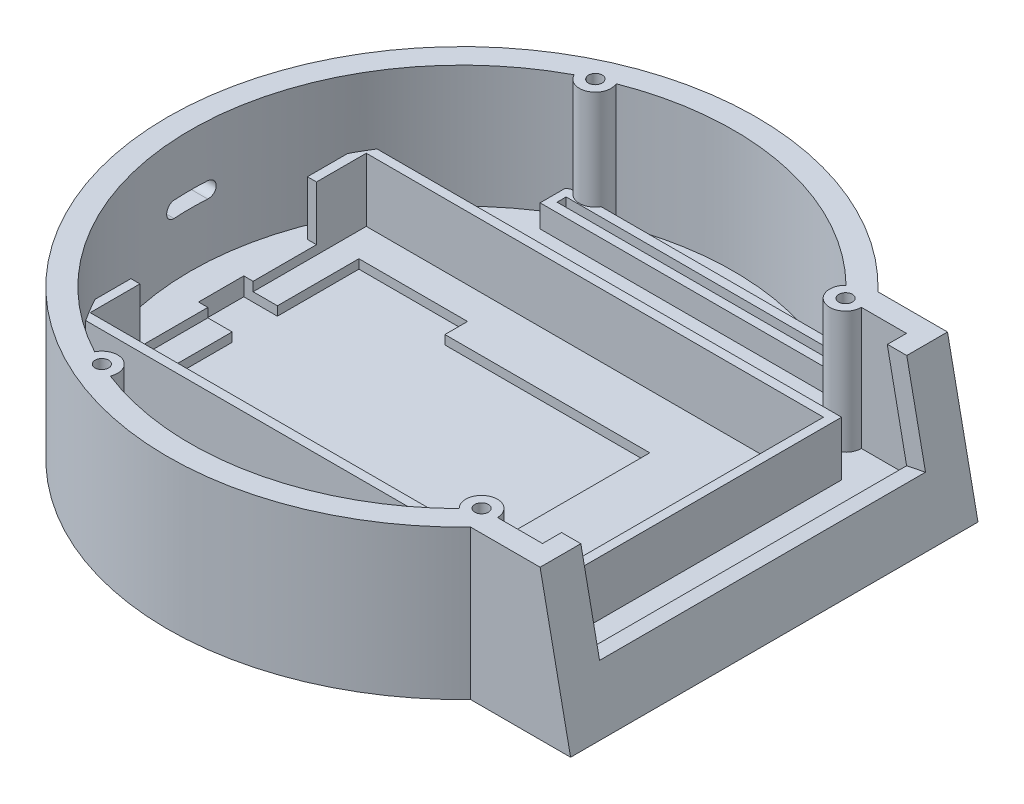
from build123d import *
from build123d.topology import SkipClean

# Parameters (mm, degrees)
SKETCH1_R                     = 65
SKETCH1_W                     = 44
SKETCH1_H                     = 90
HOUSING_DEPTH                 = 33
INTERNALCUT_DEPTH             = 27
SKETCH7_W                     = 72
SKETCH7_H                     = 25
DISPLAYCUT_DEPTH              = 27
SKETCH11_R                    = 18
WICHARGERCUT_DEPTH            = 4
SKETCH14_W                    = 6.2
SKETCH14_H                    = 6.2
BTNINTERNALCUT_DEPTH          = 3
SKETCH16_R                    = 1.9
BTNEXTERNALCUT_DEPTH          = 140.414406221
SKETCH18_R                    = 6
BUZZEREXTERNALCUT_DEPTH       = 4
SKETCH20_R                    = 0.35
BUZZERINTERNALCUT_DEPTH       = 134.776565507
SWITCHINTERNALCUT_OUTLINE_W   = 6.3
SWITCHINTERNALCUT_OUTLINE_H   = 20.3
SWITCHINTERNALCUT_DEPTH       = 0.01
SKETCH25_W                    = 4.1
SKETCH25_H                    = 7
SWITCHEXTERNALCUT_DEPTH       = 151.418380244
MICROUSBCUT_DEPTH             = 153.545075306
SKETCH29_R                    = 3.5
SKETCH29_R_2                  = 1.5
SCREWHOLESEXTERNAL_DEPTH      = 27
SCREWHOLESINTERNAL_DEPTH      = 99.564699657
SCREWHOLESINTERNAL_DEPTH_BACK = 99.564699657
SKETCH30_R                    = 1.5
SKETCH31_W                    = 59.5
SKETCH31_H                    = 2
CARDREADER_DEPTH              = 5
BATTERY_DEPTH                 = 12
SKETCH34_W                    = 68
SKETCH34_H                    = 36
WICHARGERCUT2_DEPTH           = 4
SKETCH35_W                    = 24
SKETCH35_H                    = 46
CHARGERMODULECUT_DEPTH        = 4
SKETCH36_W                    = 18.34349304
SKETCH36_H                    = 10
CHARGERCABLECUT_DEPTH         = 4
SKETCH37_R                    = 3
SKETCH37_R_2                  = 1.5
BUZZERATTACHTMENT_DEPTH       = 5
SKETCH39_W                    = 11
SKETCH39_H                    = 33
NEWEXT_DEPTH                  = 90
DIAGONALCUT_DEPTH             = 90
DISPLAYINTERNALCUT_START      = -4.8
DISPLAYINTERNALCUT_DEPTH      = 80.4
SKETCH45_W                    = 72
SKETCH45_H                    = 22
DISPLAYCUT2_DEPTH             = 5
SKETCH47_W                    = 101
SKETCH47_H                    = 61
CUT_EXTRUDE1_DEPTH            = 2
SKETCH49_R                    = 1.5
CUT_EXTRUDE2_DEPTH            = 99.561960808


# Read off the part's stored shape, not the designer's step: SwitchInternalCut
with BuildPart() as part:
    # Sketch1 → Housing (new body)
    with BuildSketch(Plane(origin=(0, 0, 0), x_dir=(1, 0, 0), z_dir=(0, 1, 0))):
        Circle(SKETCH1_R)
        with Locations((47, -0.0001724)):
            Rectangle(SKETCH1_W, SKETCH1_H)
    extrude(amount=HOUSING_DEPTH)

    # Sketch8 → InternalCut (cut)
    with BuildSketch(Plane(origin=(0, 33, 0), x_dir=(1, 0, 0), z_dir=(0, 1, 0))):
        with BuildLine():
            ThreePointArc((44.541821482, 40.1998276), (-60, 0.000232232), (44.541510291, -40.2001724))
            Line((44.541510291, -40.2001724), (19.336952431, -40.2001724))
            Line((19.336952431, -40.2001724), (19.336952431, 40.1998276))
            Line((19.336952431, 40.1998276), (44.541821482, 40.1998276))
        make_face()
        with BuildLine():
            Line((19.336952431, -40.2001724), (44.541510291, -40.2001724))
            ThreePointArc((44.541510291, -40.2001724), (56.002190214, -21.53496439), (60, 0))
            ThreePointArc((60, 0), (56.002273565, 21.534747631), (44.541821482, 40.1998276))
            Line((44.541821482, 40.1998276), (19.336952431, 40.1998276))
            Line((19.336952431, 40.1998276), (19.336952431, -40.2001724))
        make_face()
        with BuildLine():
            ThreePointArc((44.541821482, 40.1998276), (-60, 0.000232232), (44.541510291, -40.2001724))
            Line((44.541510291, -40.2001724), (19.336952431, -40.2001724))
            Line((19.336952431, -40.2001724), (19.336952431, 40.1998276))
            Line((19.336952431, 40.1998276), (44.541821482, 40.1998276))
        make_face()
        with BuildLine():
            Line((19.336952431, -40.2001724), (44.541510291, -40.2001724))
            ThreePointArc((44.541510291, -40.2001724), (56.002190214, -21.53496439), (60, 0))
            ThreePointArc((60, 0), (56.002273565, 21.534747631), (44.541821482, 40.1998276))
            Line((44.541821482, 40.1998276), (19.336952431, 40.1998276))
            Line((19.336952431, 40.1998276), (19.336952431, -40.2001724))
        make_face()
        with BuildLine():
            Line((44.541510291, -40.2001724), (64, -40.2001724))
            Line((64, -40.2001724), (64, 40.1998276))
            Line((64, 40.1998276), (44.541821482, 40.1998276))
            ThreePointArc((44.541821482, 40.1998276), (56.002273565, 21.534747631), (60, 0))
            ThreePointArc((60, 0), (56.002190214, -21.53496439), (44.541510291, -40.2001724))
        make_face()
    extrude(amount=-INTERNALCUT_DEPTH, mode=Mode.SUBTRACT)

    # Sketch7 → DisplayCut (cut)
    with BuildSketch(Plane(origin=(69, 0, 0), x_dir=(0, 0, -1), z_dir=(1, 0, 0))):
        with Locations((-0.0001724, 25.5)):
            Rectangle(SKETCH7_W, SKETCH7_H)
    extrude(amount=-DISPLAYCUT_DEPTH, mode=Mode.SUBTRACT)

    # Sketch11 → WiChargerCut (cut)
    with BuildSketch(Plane(origin=(0, 6, 0), x_dir=(1, 0, 0), z_dir=(0, 1, 0))):
        with Locations(Location((0, 0, 0), (0, 0, 270))):
            Circle(SKETCH11_R)
    extrude(amount=-WICHARGERCUT_DEPTH, mode=Mode.SUBTRACT)

    # Sketch14 → BtnInternalCut (cut)
    with BuildSketch(Plane(origin=(30.518997778, 6, -32.018027838), x_dir=(1, 0, 0), z_dir=(0, 1, 0))):
        with Locations((-1.004569722, -74.17253241)):
            Rectangle(SKETCH14_W, SKETCH14_H)
    extrude(amount=-BTNINTERNALCUT_DEPTH, mode=Mode.SUBTRACT)

    # Sketch16 → BtnExternalCut (cut, through all)
    with BuildSketch(Plane(origin=(30.518997778, 3, -32.018027838), x_dir=(1, 0, 0), z_dir=(0, 1, 0))):
        with Locations(Location((-1.004569722, -74.17253241, 0), (0, 0, 270))):
            Circle(SKETCH16_R)
    extrude(amount=-BTNEXTERNALCUT_DEPTH, mode=Mode.SUBTRACT)

    # Sketch18 → BuzzerExternalCut (cut)
    with BuildSketch(Plane(origin=(7.487765852, 6, 43.077256075), x_dir=(1, 0, 0), z_dir=(0, 1, 0))):
        with Locations(Location((-25.006618322, 0, 0), (0, 0, 270))):
            Circle(SKETCH18_R)
    extrude(amount=-BUZZEREXTERNALCUT_DEPTH, mode=Mode.SUBTRACT)

    # Sketch20 → BuzzerInternalCut (cut, through all)
    with BuildSketch(Plane(origin=(7.487765852, 2, 43.077256075), x_dir=(1, 0, 0), z_dir=(0, 1, 0))):
        with Locations(Location((-24.042348329, 4.522315504, 0), (0, 0, 270))):
            Circle(SKETCH20_R)
        with Locations(Location((-26.042348329, 3.020429056, 0), (0, 0, 270))):
            Circle(SKETCH20_R)
        with Locations(Location((-28.042348329, 3.020429056, 0), (0, 0, 270))):
            Circle(SKETCH20_R)
        with Locations(Location((-30.042348329, 1.518542609, 0), (0, 0, 270))):
            Circle(SKETCH20_R)
        with Locations(Location((-30.042348329, 0.016656161, 0), (0, 0, 270))):
            Circle(SKETCH20_R)
        with Locations(Location((-30.042348329, -1.485230286, 0), (0, 0, 270))):
            Circle(SKETCH20_R)
        with Locations(Location((-28.042348329, 0.016656161, 0), (0, 0, 270))):
            Circle(SKETCH20_R)
        with Locations(Location((-28.042348329, 1.518542609, 0), (0, 0, 270))):
            Circle(SKETCH20_R)
        with Locations(Location((-28.042348329, -1.485230286, 0), (0, 0, 270))):
            Circle(SKETCH20_R)
        with Locations(Location((-28.042348329, -2.987116733, 0), (0, 0, 270))):
            Circle(SKETCH20_R)
        with Locations(Location((-26.042348329, 0.016656161, 0), (0, 0, 270))):
            Circle(SKETCH20_R)
        with Locations(Location((-26.042348329, 1.518542609, 0), (0, 0, 270))):
            Circle(SKETCH20_R)
        with Locations(Location((-26.042348329, -1.485230286, 0), (0, 0, 270))):
            Circle(SKETCH20_R)
        with Locations(Location((-26.042348329, -2.987116733, 0), (0, 0, 270))):
            Circle(SKETCH20_R)
        with Locations(Location((-26.042348329, -4.489003181, 0), (0, 0, 270))):
            Circle(SKETCH20_R)
        with Locations(Location((-24.042348329, -4.489003181, 0), (0, 0, 270))):
            Circle(SKETCH20_R)
        with Locations(Location((-24.042348329, -2.987116733, 0), (0, 0, 270))):
            Circle(SKETCH20_R)
        with Locations(Location((-24.042348329, -1.485230286, 0), (0, 0, 270))):
            Circle(SKETCH20_R)
        with Locations(Location((-24.042348329, 0.016656161, 0), (0, 0, 270))):
            Circle(SKETCH20_R)
        with Locations(Location((-24.042348329, 1.518542609, 0), (0, 0, 270))):
            Circle(SKETCH20_R)
        with Locations(Location((-24.042348329, 3.020429056, 0), (0, 0, 270))):
            Circle(SKETCH20_R)
        with Locations(Location((-22.042348329, 3.020429056, 0), (0, 0, 270))):
            Circle(SKETCH20_R)
        with Locations(Location((-22.042348329, 1.518542609, 0), (0, 0, 270))):
            Circle(SKETCH20_R)
        with Locations(Location((-22.042348329, 0.016656161, 0), (0, 0, 270))):
            Circle(SKETCH20_R)
        with Locations(Location((-22.042348329, -1.485230286, 0), (0, 0, 270))):
            Circle(SKETCH20_R)
        with Locations(Location((-22.042348329, -2.987116733, 0), (0, 0, 270))):
            Circle(SKETCH20_R)
        with Locations(Location((-20.042348329, -1.485230286, 0), (0, 0, 270))):
            Circle(SKETCH20_R)
        with Locations(Location((-20.042348329, 0.016656161, 0), (0, 0, 270))):
            Circle(SKETCH20_R)
        with Locations(Location((-20.042348329, 1.518542609, 0), (0, 0, 270))):
            Circle(SKETCH20_R)
        with Locations(Location((-26.042348329, 4.522315504, 0), (0, 0, 270))):
            Circle(SKETCH20_R)
    extrude(amount=-BUZZERINTERNALCUT_DEPTH, mode=Mode.SUBTRACT)

    # SwitchInternalCut outline → SwitchInternalCut (add)
    with BuildSketch(Plane(origin=(-4.277787828, 6, 63.55969363), x_dir=(1, 0, 0), z_dir=(0, 1, 0))):
        with Locations((24.709044431, 19.499064282)):
            Rectangle(SWITCHINTERNALCUT_OUTLINE_W, SWITCHINTERNALCUT_OUTLINE_H)
    extrude(amount=SWITCHINTERNALCUT_DEPTH)

    # Sketch25 → SwitchExternalCut (cut, through all)
    with BuildSketch(Plane(origin=(-4.277787828, 6.01, 63.55969363), x_dir=(1, 0, 0), z_dir=(0, 1, 0))):
        with Locations((24.709044431, 19.499064282)):
            Rectangle(SKETCH25_W, SKETCH25_H)
    extrude(amount=-SWITCHEXTERNALCUT_DEPTH, mode=Mode.SUBTRACT)

    # Sketch28 → MicroUSBCut (cut, through all)
    with BuildSketch(Plane(origin=(69, 0, 0), x_dir=(0, 0, -1), z_dir=(1, 0, 0))):
        with BuildLine():
            Line((-3.7251724, 21.5), (3.7248276, 21.5))
            ThreePointArc((3.7248276, 21.5), (5.4748276, 19.75), (3.7248276, 18))
            Line((3.7248276, 18), (-3.7251724, 18))
            ThreePointArc((-3.7251724, 18), (-5.4751724, 19.75), (-3.7251724, 21.5))
        make_face()
    extrude(amount=-MICROUSBCUT_DEPTH, mode=Mode.SUBTRACT)

    # Sketch29 → ScrewHolesExternal (add)
    # profile 1 of 4: a face of its own
    with BuildSketch(Plane(origin=(0, 6, 0), x_dir=(1, 0, 0), z_dir=(0, 1, 0))):
        with Locations((-25, 54.445965177)):
            Circle(SKETCH29_R)
        with Locations((-25, 54.445965177)):
            Circle(SKETCH29_R_2, mode=Mode.SUBTRACT)
    # profile 2 of 4: a face of its own
    with BuildSketch(Plane(origin=(0, 6, 0), x_dir=(1, 0, 0), z_dir=(0, 1, 0))):
        with Locations((-25, -54.543560573)):
            Circle(SKETCH29_R)
        with Locations((-25, -54.543560573)):
            Circle(SKETCH29_R_2, mode=Mode.SUBTRACT)
    # profile 3 of 4: a face of its own
    with BuildSketch(Plane(origin=(0, 6, 0), x_dir=(1, 0, 0), z_dir=(0, 1, 0))):
        with Locations((44.541821482, 40.1998276)):
            Circle(SKETCH29_R)
        with Locations((44.541821482, 40.1998276)):
            Circle(SKETCH29_R_2, mode=Mode.SUBTRACT)
    # profile 4 of 4: a face of its own
    with BuildSketch(Plane(origin=(0, 6, 0), x_dir=(1, 0, 0), z_dir=(0, 1, 0))):
        with Locations((44.541510291, -40.2001724)):
            Circle(SKETCH29_R)
        with Locations((44.541510291, -40.2001724)):
            Circle(SKETCH29_R_2, mode=Mode.SUBTRACT)
    extrude(amount=SCREWHOLESEXTERNAL_DEPTH)

    # Sketch30 → ScrewHolesInternal (cut, two sides: drawn at the far end of the back side and taken through both)
    with SkipClean():  # the faces are left unmerged after this step: merging them gives an invalid solid
        with BuildSketch(Plane(origin=(0, 6, 0), x_dir=(1, 0, 0), z_dir=(0, 1, 0)).offset(-SCREWHOLESINTERNAL_DEPTH_BACK)):
            with Locations(Location((44.541821482, 40.1998276, 0), (0, 0, 270))):
                Circle(SKETCH30_R)
            with Locations(Location((-25, -54.543560573, 0), (0, 0, 270))):
                Circle(SKETCH30_R)
            with Locations(Location((44.541510291, -40.2001724, 0), (0, 0, 270))):
                Circle(SKETCH30_R)
            with Locations(Location((-25.037015645, 54.526579277, 0), (0, 0, 270))):
                Circle(SKETCH30_R)
        extrude(amount=SCREWHOLESINTERNAL_DEPTH + SCREWHOLESINTERNAL_DEPTH_BACK, mode=Mode.SUBTRACT)

    # Sketch31 → CardReader (add)
    with SkipClean():  # the faces are left unmerged after this step: merging them gives an invalid solid
        with BuildSketch(Plane(origin=(0.975227964, 6, -2.088376012), x_dir=(1, 0, 0), z_dir=(0, 1, 0))):
            Polygon((30.831609754, 50.620558061), (-30.418390246, 50.620558061), (-30.418390246, 44.620558061), (32.581609754, 44.620558061), (32.581609754, 47.725008054), align=None)
            with Locations((1.081609754, 47.620558061)):
                Rectangle(SKETCH31_W, SKETCH31_H, mode=Mode.SUBTRACT)
        extrude(amount=CARDREADER_DEPTH)

    # Sketch32 → Battery (add)
    with SkipClean():  # the faces are left unmerged after this step: merging them gives an invalid solid
        with BuildSketch(Plane(origin=(0, 6, 0), x_dir=(1, 0, 0), z_dir=(0, 1, 0))):
            Polygon((-53.132079202, -20), (-51.132079202, -20), (-51.132079202, -31), (49.867920798, -31), (49.867920798, 30), (-51.132079202, 30), (-51.132079202, 19), (-53.132079202, 19), (-53.132079202, 32), (51.867920798, 32), (51.867920798, -33), (-53.132079202, -33), align=None)
        extrude(amount=BATTERY_DEPTH)

    # Sketch34 → WiChargerCut2 (cut)
    with SkipClean():  # the faces are left unmerged after this step: merging them gives an invalid solid
        with BuildSketch(Plane(origin=(0, 6, 0), x_dir=(1, 0, 0), z_dir=(0, 1, 0))):
            with Locations((-10.5, 0)):
                Rectangle(SKETCH34_W, SKETCH34_H)
        extrude(amount=-WICHARGERCUT2_DEPTH, mode=Mode.SUBTRACT)

    # Sketch35 → ChargerModuleCut (cut)
    with SkipClean():  # the faces are left unmerged after this step: merging them gives an invalid solid
        with BuildSketch(Plane(origin=(0, 6, 0), x_dir=(1, 0, 0), z_dir=(0, 1, 0))):
            with Locations((-33.763525433, 0)):
                Rectangle(SKETCH35_W, SKETCH35_H)
        extrude(amount=-CHARGERMODULECUT_DEPTH, mode=Mode.SUBTRACT)

    # Sketch36 → ChargerCableCut (cut)
    with SkipClean():  # the faces are left unmerged after this step: merging them gives an invalid solid
        with BuildSketch(Plane(origin=(0, 6, 0), x_dir=(1, 0, 0), z_dir=(0, 1, 0))):
            with Locations((-44.020906375, 0)):
                Rectangle(SKETCH36_W, SKETCH36_H)
        extrude(amount=-CHARGERCABLECUT_DEPTH, mode=Mode.SUBTRACT)

    # Sketch37 → BuzzerAttachtment (add)
    with SkipClean():  # the faces are left unmerged after this step: merging them gives an invalid solid
        with BuildSketch(Plane(origin=(0, 6, 0), x_dir=(1, 0, 0), z_dir=(0, 1, 0))):
            with Locations(Location((-6.51885247, -43.683031415, 0), (0, 0, 270))):
                Circle(SKETCH37_R)
            with Locations(Location((-6.51885247, -43.683031415, 0), (0, 0, 270))):
                Circle(SKETCH37_R_2, mode=Mode.SUBTRACT)
        extrude(amount=BUZZERATTACHTMENT_DEPTH)

    # Sketch39 → NewExt (add)
    with SkipClean():  # the faces are left unmerged after this step: merging them gives an invalid solid
        with BuildSketch(Plane.XY.offset(45.0001724)):
            with Locations((63.5, 16.5)):
                Rectangle(SKETCH39_W, SKETCH39_H)
        extrude(amount=-NEWEXT_DEPTH)

    # Sketch38 → DiagonalCut (cut)
    with SkipClean():  # the faces are left unmerged after this step: merging them gives an invalid solid
        with BuildSketch(Plane(origin=(0, 0, -44.9998276), x_dir=(-1, 0, 0), z_dir=(0, 0, -1))):
            Polygon((-59, 49), (-69, 0), (-69, 49), align=None)
        extrude(amount=-DIAGONALCUT_DEPTH, mode=Mode.SUBTRACT)

    # Sketch43 → DisplayInternalCut (cut)
    with SkipClean():  # the faces are left unmerged after this step: merging them gives an invalid solid
        with BuildSketch(Plane.XY.offset(45.0001724).offset(DISPLAYINTERNALCUT_START)):
            Polygon((63.830449902, 4), (57.951996098, 33), (57.951996098, 6), (61.425039295, 6), (61.830449902, 4), align=None)
        extrude(amount=-DISPLAYINTERNALCUT_DEPTH, mode=Mode.SUBTRACT)

    # Sketch45 → DisplayCut2 (cut)
    with SkipClean():  # the faces are left unmerged after this step: merging them gives an invalid solid
        with BuildSketch(Plane(origin=(66.241103559, 13.518592563, 0), x_dir=(0, 0, -1), z_dir=(0.979804058780407, 0.1999600119960014, 0))):
            with Locations((-0.0001724, 10.202759172)):
                Rectangle(SKETCH45_W, SKETCH45_H)
        extrude(amount=-DISPLAYCUT2_DEPTH, mode=Mode.SUBTRACT)

    # Sketch47 → Cut-Extrude1 (cut)
    with SkipClean():  # the faces are left unmerged after this step: merging them gives an invalid solid
        with BuildSketch(Plane(origin=(0, 6, 0), x_dir=(1, 0, 0), z_dir=(0, 1, 0))):
            with Locations((-0.632079202, -0.5)):
                Rectangle(SKETCH47_W, SKETCH47_H)
        extrude(amount=-CUT_EXTRUDE1_DEPTH, mode=Mode.SUBTRACT)

    # Sketch49 → Cut-Extrude2 (cut, through all)
    with SkipClean():  # the faces are left unmerged after this step: merging them gives an invalid solid
        with BuildSketch(Plane(origin=(0, 6.01, 0), x_dir=(1, 0, 0), z_dir=(0, 1, 0))):
            with Locations(Location((20.431256603, -51.210629348, 0), (0, 0, 270))):
                Circle(SKETCH49_R)
            with Locations(Location((20.431256603, -36.910629348, 0), (0, 0, 270))):
                Circle(SKETCH49_R)
        extrude(amount=-CUT_EXTRUDE2_DEPTH, mode=Mode.SUBTRACT)


solid = part.part
